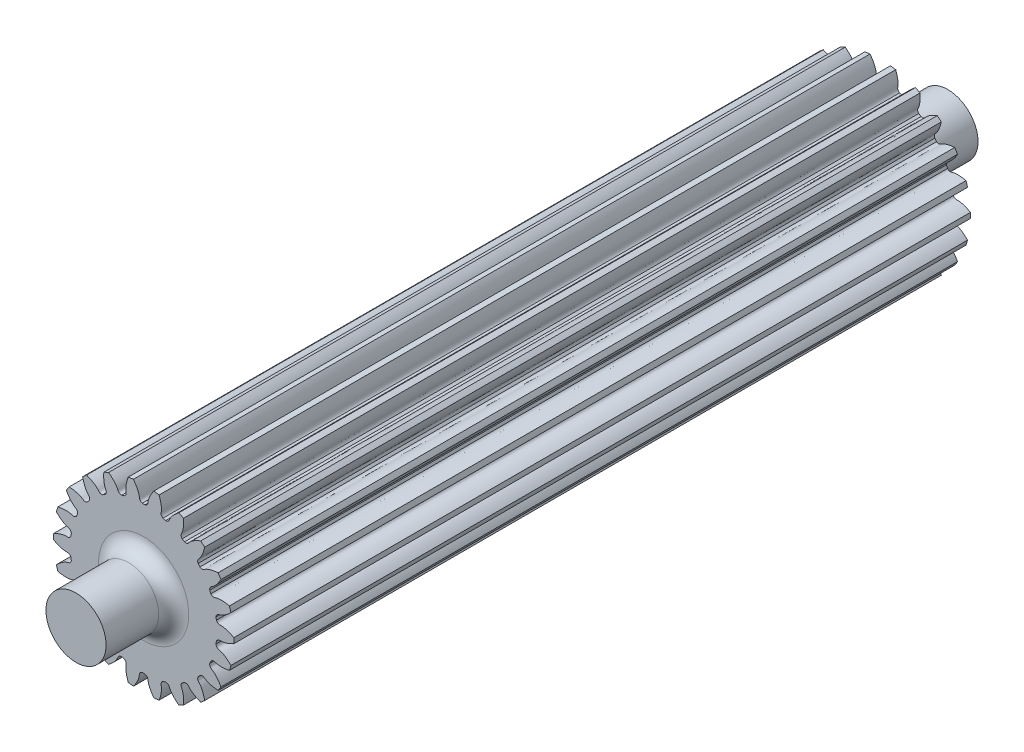
from build123d import *
from build123d.topology import SkipClean

# Parameters (mm, degrees)
SKETCH_1_R               = 12
EXTRUDE_1_DEPTH          = 30
CUT_EXTRUDE_1_DEPTH      = 35.467375879
PATTERN_CIRCULAR_1_COUNT = 22
EXTRUDE_START            = 68
EXTRUDE_2_DEPTH          = 68
SKETCH_19_R              = 4
EXTRUDE_3_DEPTH          = 9
EXTRUDE_START_2          = 9
SKETCH_20_R              = 4
EXTRUDE_4_DEPTH          = 9
FILLET_1_R               = 2
FILLET_2_R               = 2


with BuildPart() as part:
    # 草图1 → 凸台-拉伸1 (new body)
    with BuildSketch(Plane.XY):
        Circle(SKETCH_1_R)
    extrude(amount=EXTRUDE_1_DEPTH)

    # 草图2 → 切除-拉伸1 (cut, through all)
    with BuildSketch(Plane.XY):
        with BuildLine():
            ThreePointArc((0.185665431, 9.748232063), (0, 9.75), (-0.185665431, 9.748232063))
            add(Edge.make_bspline(
                [(-0.185665431, 9.748232063), (-0.588158706, 9.876186429), (-0.548347264, 10.151774696), (-0.599584047, 10.42157039), (-0.60596118, 10.451918903), (-0.613876897, 10.486162213), (-0.623483721, 10.524250431), (-0.634939934, 10.566127653), (-0.648399943, 10.611733662), (-0.664017171, 10.661003439), (-0.681942991, 10.713867378), (-0.70232689, 10.77025128), (-0.72531626, 10.830076418), (-0.751056303, 10.893259589), (-0.779689902, 10.959713172), (-0.811357505, 11.029345185), (-0.846197011, 11.10205935), (-0.884343649, 11.177755162), (-0.925929868, 11.25632795), (-0.971085225, 11.337668957), (-1.019936271, 11.421665408), (-1.072606448, 11.508200591), (-1.129215979, 11.597153935), (-1.189881763, 11.688401095), (-1.254717274, 11.781814033), (-1.323832459, 11.877261111), (-1.397333644, 11.974607178), (-1.475323431, 12.073713662), (-1.557900608, 12.174438668), (-1.64516006, 12.276637076), (-1.737192673, 12.380160638), (-1.834085256, 12.484858081), (-1.935920447, 12.590575215), (-2.042776642, 12.697155033), (-2.154727905, 12.804437827), (-2.271843904, 12.912261294), (-2.394189822, 13.020460649), (-2.521826308, 13.128868741), (-2.654809363, 13.237316171), (-2.841488127, 13.383435539), (-2.986445715, 13.489968103), (-3.085558798, 13.559868128)],
                knots=[0, 0, 0, 0, 0.157021319, 0.162530984, 0.168888289, 0.176093235, 0.184145822, 0.19304605, 0.202793918, 0.213389427, 0.224832576, 0.237123367, 0.250261798, 0.264247869, 0.279081582, 0.294762935, 0.311291928, 0.328668563, 0.346892838, 0.365964754, 0.38588431, 0.406651508, 0.428266346, 0.450728824, 0.474038944, 0.498196704, 0.523202104, 0.549055146, 0.575755828, 0.603304151, 0.631700114, 0.660943719, 0.691034964, 0.721973849, 0.753760376, 0.786394543, 0.819876351, 0.854205799, 0.889382888, 0.925407618, 1, 1, 1, 1], degree=3))
            ThreePointArc((-3.085558798, 13.559868128), (0, 13.906498364), (3.085558798, 13.559868128))
            add(Edge.make_bspline(
                [(0.185665431, 9.748232063), (0.588158706, 9.876186429), (0.548347264, 10.151774696), (0.599584047, 10.42157039), (0.60596118, 10.451918903), (0.613876897, 10.486162213), (0.623483721, 10.524250431), (0.634939934, 10.566127653), (0.648399943, 10.611733662), (0.664017171, 10.661003439), (0.681942991, 10.713867378), (0.70232689, 10.77025128), (0.72531626, 10.830076418), (0.751056303, 10.893259589), (0.779689902, 10.959713172), (0.811357505, 11.029345185), (0.846197011, 11.10205935), (0.884343649, 11.177755162), (0.925929868, 11.25632795), (0.971085225, 11.337668957), (1.019936271, 11.421665408), (1.072606448, 11.508200591), (1.129215979, 11.597153935), (1.189881763, 11.688401095), (1.254717274, 11.781814033), (1.323832459, 11.877261111), (1.397333644, 11.974607178), (1.475323431, 12.073713662), (1.557900608, 12.174438668), (1.64516006, 12.276637076), (1.737192673, 12.380160638), (1.834085256, 12.484858081), (1.935920447, 12.590575215), (2.042776642, 12.697155033), (2.154727905, 12.804437827), (2.271843904, 12.912261294), (2.394189822, 13.020460649), (2.521826308, 13.128868741), (2.654809363, 13.237316171), (2.841488127, 13.383435539), (2.986445715, 13.489968103), (3.085558798, 13.559868128)],
                knots=[0, 0, 0, 0, 0.157021319, 0.162530984, 0.168888289, 0.176093235, 0.184145822, 0.19304605, 0.202793918, 0.213389427, 0.224832576, 0.237123367, 0.250261798, 0.264247869, 0.279081582, 0.294762935, 0.311291928, 0.328668563, 0.346892838, 0.365964754, 0.38588431, 0.406651508, 0.428266346, 0.450728824, 0.474038944, 0.498196704, 0.523202104, 0.549055146, 0.575755828, 0.603304151, 0.631700114, 0.660943719, 0.691034964, 0.721973849, 0.753760376, 0.786394543, 0.819876351, 0.854205799, 0.889382888, 0.925407618, 1, 1, 1, 1], degree=3))
        make_face()
    cut_extrude_1 = extrude(amount=CUT_EXTRUDE_1_DEPTH, mode=Mode.SUBTRACT)

    # 阵列(圆周)1: 切除-拉伸1 ×22 about axis
    pattern_circular_1_axis = Axis((0, 0, -1.5), (0, 0, 1))
    for i in range(1, PATTERN_CIRCULAR_1_COUNT):
        add(cut_extrude_1.rotate(pattern_circular_1_axis, i * 360 / PATTERN_CIRCULAR_1_COUNT), mode=Mode.SUBTRACT)

    # 草图4 → 凸台-拉伸2 (add)
    with BuildSketch(Plane(origin=(0, 0, 0), x_dir=(-1, 0, 0), z_dir=(0, 0, -1)).offset(EXTRUDE_START)):
        with BuildLine():
            ThreePointArc((2.924539021, 9.301052173), (2.746892429, 9.355056493), (2.568249667, 9.405668166))
            add(Edge.make_bspline(
                [(2.568249667, 9.405668166), (2.218109108, 9.641834941), (2.333950094, 9.895043767), (2.361944393, 10.180005258), (2.365849304, 10.238460497), (2.368085913, 10.32113962), (2.366834845, 10.420382901), (2.360772595, 10.536017252), (2.34858845, 10.667790208), (2.32898426, 10.815370787), (2.300679804, 10.978350119), (2.26241667, 11.156242389), (2.212962422, 11.348485973), (2.151114634, 11.554444777), (2.096274933, 11.713680077), (2.062581682, 11.80433527), (2.055688884, 11.822611522)],
                knots=[0, 0, 0, 0, 0.157021319, 0.162530984, 0.176093235, 0.19304605, 0.213389427, 0.237123367, 0.264247869, 0.294762935, 0.328668563, 0.365964754, 0.406651508, 0.450728824, 0.498196704, 0.510209942, 0.510209942, 0.510209942, 0.510209942], degree=3))
            ThreePointArc((2.055688884, 11.822611522), (1.707778059, 11.877857303), (1.358395532, 11.922867171))
            add(Edge.make_bspline(
                [(1.358395532, 11.922867171), (1.300155371, 11.845656586), (1.201946581, 11.708817962), (1.073915974, 11.512256119), (0.972303664, 11.341732625), (0.885472389, 11.181826213), (0.812397844, 11.033422979), (0.752009469, 10.897343589), (0.703194045, 10.774341044), (0.670055832, 10.680054419), (0.644027119, 10.597938124), (0.627360159, 10.539619361), (0.611348785, 10.476138997), (0.60176986, 10.433080149), (0.548347264, 10.151774696), (0.588158706, 9.876186429), (0.185665431, 9.748232063)],
                knots=[0.489790058, 0.489790058, 0.489790058, 0.489790058, 0.549271176, 0.593348492, 0.634035246, 0.671331437, 0.705237065, 0.735752131, 0.762876633, 0.786610573, 0.797206082, 0.815854178, 0.823906765, 0.837469016, 0.842978681, 1, 1, 1, 1], degree=3))
            ThreePointArc((0.185665431, 9.748232063), (0, 9.75), (-0.185665431, 9.748232063))
            add(Edge.make_bspline(
                [(-0.185665431, 9.748232063), (-0.588158706, 9.876186429), (-0.548347264, 10.151774696), (-0.60176986, 10.433080149), (-0.61449187, 10.490267681), (-0.635639261, 10.570227844), (-0.664799714, 10.665098608), (-0.703194362, 10.774341023), (-0.752009695, 10.897343577), (-0.812398032, 11.033422968), (-0.885472542, 11.181826205), (-0.972303795, 11.341732617), (-1.073916075, 11.512256114), (-1.191283893, 11.692447604), (-1.288763969, 11.829782626), (-1.346632927, 11.907273161), (-1.358395532, 11.922867171)],
                knots=[0, 0, 0, 0, 0.157021319, 0.162530984, 0.176093235, 0.19304605, 0.213389427, 0.237123367, 0.264247869, 0.294762935, 0.328668563, 0.365964754, 0.406651508, 0.450728824, 0.498196704, 0.510209942, 0.510209942, 0.510209942, 0.510209942], degree=3))
            ThreePointArc((-1.358395532, 11.922867171), (-1.707778059, 11.877857303), (-2.055688884, 11.822611522))
            add(Edge.make_bspline(
                [(-2.055688884, 11.822611522), (-2.089817174, 11.732120359), (-2.145495923, 11.573156047), (-2.21296252, 11.34848595), (-2.262416797, 11.156242359), (-2.300679954, 10.978350084), (-2.328984444, 10.815370745), (-2.348588671, 10.667790156), (-2.360772906, 10.536017183), (-2.366005176, 10.436213716), (-2.36784471, 10.350090571), (-2.367406247, 10.289438503), (-2.364884562, 10.224018615), (-2.361944393, 10.180005258), (-2.333950094, 9.895043767), (-2.218109108, 9.641834941), (-2.568249667, 9.405668166)],
                knots=[0.489790058, 0.489790058, 0.489790058, 0.489790058, 0.549271176, 0.593348492, 0.634035246, 0.671331437, 0.705237065, 0.735752131, 0.762876633, 0.786610573, 0.797206082, 0.815854178, 0.823906765, 0.837469016, 0.842978681, 1, 1, 1, 1], degree=3))
            ThreePointArc((-2.568249667, 9.405668166), (-2.746892429, 9.355056493), (-2.924539021, 9.301052173))
            add(Edge.make_bspline(
                [(-2.924539021, 9.301052173), (-3.3467774, 9.310428028), (-3.386220788, 9.586069213), (-3.516732299, 9.840928935), (-3.545050567, 9.892215766), (-3.587868721, 9.962979072), (-3.642576155, 10.045791454), (-3.710192695, 10.139791761), (-3.791684488, 10.244058979), (-3.887964667, 10.357612838), (-3.999889169, 10.479417233), (-4.128253989, 10.608383121), (-4.273792278, 10.74337173), (-4.437171685, 10.883197863), (-4.569394878, 10.987506541), (-4.646751344, 11.045554595), (-4.662430821, 11.057203029)],
                knots=[0, 0, 0, 0, 0.157021319, 0.162530984, 0.176093235, 0.19304605, 0.213389427, 0.237123367, 0.264247869, 0.294762935, 0.328668563, 0.365964754, 0.406651508, 0.450728824, 0.498196704, 0.510209942, 0.510209942, 0.510209942, 0.510209942], degree=3))
            ThreePointArc((-4.662430821, 11.057203029), (-4.984980156, 10.915583944), (-5.303233613, 10.7645582))
            add(Edge.make_bspline(
                [(-5.303233613, 10.7645582), (-5.310485161, 10.668117515), (-5.319123107, 10.499905858), (-5.320559952, 10.265328941), (-5.313849705, 10.066939687), (-5.300444889, 9.885473322), (-5.281686262, 9.721121495), (-5.258918124, 9.573995807), (-5.233484075, 9.44412787), (-5.210386516, 9.346893044), (-5.187887842, 9.263740235), (-5.170379477, 9.205668531), (-5.149529026, 9.143609049), (-5.134307959, 9.102206883), (-5.027164697, 8.83667524), (-4.844678915, 8.626359328), (-5.114100451, 8.301112972)],
                knots=[0.489790058, 0.489790058, 0.489790058, 0.489790058, 0.549271176, 0.593348492, 0.634035246, 0.671331437, 0.705237065, 0.735752131, 0.762876633, 0.786610573, 0.797206082, 0.815854178, 0.823906765, 0.837469016, 0.842978681, 1, 1, 1, 1], degree=3))
            ThreePointArc((-5.114100451, 8.301112972), (-5.27124797, 8.202221945), (-5.426483851, 8.100356351))
            add(Edge.make_bspline(
                [(-5.426483851, 8.100356351), (-5.834260094, 7.99039412), (-5.949762843, 8.243757414), (-6.146790001, 8.451524185), (-6.188410351, 8.49275536), (-6.249430396, 8.548588987), (-6.325252738, 8.612634021), (-6.41661328, 8.683776874), (-6.524179553, 8.760861647), (-6.648551527, 8.842690515), (-6.790258564, 8.928028199), (-6.949757596, 9.015605514), (-7.127431248, 9.104123262), (-7.323586215, 9.192256156), (-7.479840591, 9.255088021), (-7.570417602, 9.288990887), (-7.588743694, 9.295750058)],
                knots=[0, 0, 0, 0, 0.157021319, 0.162530984, 0.176093235, 0.19304605, 0.213389427, 0.237123367, 0.264247869, 0.294762935, 0.328668563, 0.365964754, 0.406651508, 0.450728824, 0.498196704, 0.510209942, 0.510209942, 0.510209942, 0.510209942], degree=3))
            ThreePointArc((-7.588743694, 9.295750058), (-7.858328807, 9.068994892), (-8.121141894, 8.834424392))
            add(Edge.make_bspline(
                [(-8.121141894, 8.834424392), (-8.100929222, 8.739847235), (-8.061826571, 8.576015742), (-7.997117259, 8.350536032), (-7.934786112, 8.162073431), (-7.870799303, 7.991734302), (-7.806497272, 7.839324794), (-7.743201307, 7.704573257), (-7.68220949, 7.587131484), (-7.632653327, 7.500342686), (-7.587639155, 7.426896759), (-7.554479312, 7.376110043), (-7.516989274, 7.322438657), (-7.49072043, 7.287001839), (-7.313108313, 7.06241184), (-7.078761648, 6.912027385), (-7.245637231, 6.524050974)],
                knots=[0.489790058, 0.489790058, 0.489790058, 0.489790058, 0.549271176, 0.593348492, 0.634035246, 0.671331437, 0.705237065, 0.735752131, 0.762876633, 0.786610573, 0.797206082, 0.815854178, 0.823906765, 0.837469016, 0.842978681, 1, 1, 1, 1], degree=3))
            ThreePointArc((-7.245637231, 6.524050974), (-7.36855835, 6.384892156), (-7.488807233, 6.243417832))
            add(Edge.make_bspline(
                [(-7.488807233, 6.243417832), (-7.849085732, 6.023026001), (-8.031290497, 6.233585417), (-8.278871334, 6.377427208), (-8.330421932, 6.405262424), (-8.404700387, 6.441643063), (-8.495494963, 6.481732201), (-8.603198018, 6.52425403), (-8.728124391, 6.567911406), (-8.870512283, 6.611385996), (-9.030521594, 6.653343419), (-9.208233175, 6.692437167), (-9.403648127, 6.727312872), (-9.616687345, 6.756612524), (-9.784314102, 6.772877312), (-9.88077365, 6.77988838), (-9.900261685, 6.781210701)],
                knots=[0, 0, 0, 0, 0.157021319, 0.162530984, 0.176093235, 0.19304605, 0.213389427, 0.237123367, 0.264247869, 0.294762935, 0.328668563, 0.365964754, 0.406651508, 0.450728824, 0.498196704, 0.510209942, 0.510209942, 0.510209942, 0.510209942], degree=3))
            ThreePointArc((-9.900261685, 6.781210701), (-10.095042394, 6.487689809), (-10.281123557, 6.188578059))
            add(Edge.make_bspline(
                [(-10.281123557, 6.188578059), (-10.235084176, 6.103526509), (-10.151408791, 5.957347833), (-10.025795686, 5.759232356), (-9.912893339, 5.595964528), (-9.803508366, 5.450552498), (-9.698872299, 5.322432622), (-9.60017637, 5.210972003), (-9.508567979, 5.115470827), (-9.43656796, 5.046159169), (-9.372685068, 4.988370276), (-9.326560161, 4.948982987), (-9.275467756, 4.908047833), (-9.240279279, 4.881447244), (-9.006587387, 4.715993833), (-8.739365211, 4.637724091), (-8.790175575, 4.218449166)],
                knots=[0.489790058, 0.489790058, 0.489790058, 0.489790058, 0.549271176, 0.593348492, 0.634035246, 0.671331437, 0.705237065, 0.735752131, 0.762876633, 0.786610573, 0.797206082, 0.815854178, 0.823906765, 0.837469016, 0.842978681, 1, 1, 1, 1], degree=3))
            ThreePointArc((-8.790175575, 4.218449166), (-8.868911955, 4.050296377), (-8.94443199, 3.880674732))
            add(Edge.make_bspline(
                [(-8.94443199, 3.880674732), (-9.228025124, 3.567708136), (-9.462170759, 3.718405401), (-9.740247748, 3.786669007), (-9.797552271, 3.798853219), (-9.879071537, 3.812833528), (-9.97748271, 3.825718986), (-10.092802818, 3.836174925), (-10.2249685, 3.842868044), (-10.373836889, 3.844466303), (-10.53918547, 3.839644323), (-10.720712465, 3.827087362), (-10.91803736, 3.805495601), (-11.130701659, 3.773588328), (-11.296120675, 3.741968363), (-11.390648179, 3.721519639), (-11.409719353, 3.717297982)],
                knots=[0, 0, 0, 0, 0.157021319, 0.162530984, 0.176093235, 0.19304605, 0.213389427, 0.237123367, 0.264247869, 0.294762935, 0.328668563, 0.365964754, 0.406651508, 0.450728824, 0.498196704, 0.510209942, 0.510209942, 0.510209942, 0.510209942], degree=3))
            ThreePointArc((-11.409719353, 3.717297982), (-11.513915683, 3.380790682), (-11.608189734, 3.041369937))
            add(Edge.make_bspline(
                [(-11.608189734, 3.041369937), (-11.540053481, 2.972734366), (-11.418584245, 2.856051033), (-11.242243773, 2.701349926), (-11.087916901, 2.576503859), (-10.941995486, 2.467799346), (-10.805502374, 2.374348612), (-10.679402238, 2.295208787), (-10.564598841, 2.229385146), (-10.475987977, 2.183165848), (-10.398411779, 2.145715701), (-10.343058573, 2.120918762), (-10.282503004, 2.096036163), (-10.241245656, 2.080426825), (-9.970406315, 1.987514054), (-9.69195738, 1.987699973), (-9.62258617, 1.571093695)],
                knots=[0.489790058, 0.489790058, 0.489790058, 0.489790058, 0.549271176, 0.593348492, 0.634035246, 0.671331437, 0.705237065, 0.735752131, 0.762876633, 0.786610573, 0.797206082, 0.815854178, 0.823906765, 0.837469016, 0.842978681, 1, 1, 1, 1], degree=3))
            ThreePointArc((-9.62258617, 1.571093695), (-9.650759058, 1.387569673), (-9.675432062, 1.203542444))
            add(Edge.make_bspline(
                [(-9.675432062, 1.203542444), (-9.859364802, 0.823355776), (-10.126482219, 0.901982294), (-10.412527217, 0.889137403), (-10.470943193, 0.88468352), (-10.553099064, 0.875130897), (-10.651154146, 0.859768772), (-10.764748758, 0.837311742), (-10.893446471, 0.806498368), (-11.036734926, 0.766090814), (-11.194027219, 0.71488008), (-11.36466339, 0.651689699), (-11.547912138, 0.575379709), (-11.742972721, 0.484850449), (-11.892782731, 0.407907392), (-11.977720136, 0.361655509), (-11.994829415, 0.352231889)],
                knots=[0, 0, 0, 0, 0.157021319, 0.162530984, 0.176093235, 0.19304605, 0.213389427, 0.237123367, 0.264247869, 0.294762935, 0.328668563, 0.365964754, 0.406651508, 0.450728824, 0.498196704, 0.510209942, 0.510209942, 0.510209942, 0.510209942], degree=3))
            ThreePointArc((-11.994829415, 0.352231889), (-12, 0), (-11.994829415, -0.352231889))
            add(Edge.make_bspline(
                [(-11.994829415, -0.352231889), (-11.910116284, -0.398891037), (-11.760693911, -0.476626036), (-11.547912129, -0.57537981), (-11.364663379, -0.651689829), (-11.194027205, -0.714880233), (-11.03673491, -0.766091002), (-10.89344645, -0.806498594), (-10.764748734, -0.83731206), (-10.666705752, -0.856694587), (-10.58172101, -0.870771999), (-10.521623893, -0.878969688), (-10.456511011, -0.885783891), (-10.412527217, -0.889137403), (-10.126482219, -0.901982294), (-9.859364802, -0.823355776), (-9.675432062, -1.203542444)],
                knots=[0.489790058, 0.489790058, 0.489790058, 0.489790058, 0.549271176, 0.593348492, 0.634035246, 0.671331437, 0.705237065, 0.735752131, 0.762876633, 0.786610573, 0.797206082, 0.815854178, 0.823906765, 0.837469016, 0.842978681, 1, 1, 1, 1], degree=3))
            ThreePointArc((-9.675432062, -1.203542444), (-9.650759058, -1.387569673), (-9.62258617, -1.571093695))
            add(Edge.make_bspline(
                [(-9.62258617, -1.571093695), (-9.69195738, -1.987699973), (-9.970406315, -1.987514054), (-10.241245656, -2.080426825), (-10.296040571, -2.101157977), (-10.372177267, -2.133469636), (-10.461932418, -2.175834796), (-10.564598775, -2.229385458), (-10.679402194, -2.29520901), (-10.805502337, -2.374348797), (-10.941995455, -2.467799496), (-11.087916875, -2.576503987), (-11.242243753, -2.701350024), (-11.403897972, -2.843167131), (-11.52596226, -2.959199811), (-11.594428442, -3.027507799), (-11.608189734, -3.041369937)],
                knots=[0, 0, 0, 0, 0.157021319, 0.162530984, 0.176093235, 0.19304605, 0.213389427, 0.237123367, 0.264247869, 0.294762935, 0.328668563, 0.365964754, 0.406651508, 0.450728824, 0.498196704, 0.510209942, 0.510209942, 0.510209942, 0.510209942], degree=3))
            ThreePointArc((-11.608189734, -3.041369937), (-11.513915683, -3.380790682), (-11.409719353, -3.717297982))
            add(Edge.make_bspline(
                [(-11.409719353, -3.717297982), (-11.315292297, -3.73820066), (-11.150022101, -3.770689699), (-10.918037323, -3.805495695), (-10.720712418, -3.827087483), (-10.539185414, -3.839644466), (-10.373836821, -3.844466479), (-10.224968417, -3.842868255), (-10.092802706, -3.836175223), (-9.993270464, -3.827150722), (-9.907762136, -3.816714931), (-9.847789818, -3.807649241), (-9.783394683, -3.795843002), (-9.740247748, -3.786669007), (-9.462170759, -3.718405401), (-9.228025124, -3.567708136), (-8.94443199, -3.880674732)],
                knots=[0.489790058, 0.489790058, 0.489790058, 0.489790058, 0.549271176, 0.593348492, 0.634035246, 0.671331437, 0.705237065, 0.735752131, 0.762876633, 0.786610573, 0.797206082, 0.815854178, 0.823906765, 0.837469016, 0.842978681, 1, 1, 1, 1], degree=3))
            ThreePointArc((-8.94443199, -3.880674732), (-8.868911955, -4.050296377), (-8.790175575, -4.218449166))
            add(Edge.make_bspline(
                [(-8.790175575, -4.218449166), (-8.739365211, -4.637724091), (-9.006587387, -4.715993833), (-9.240279279, -4.881447244), (-9.287013975, -4.916776151), (-9.350963354, -4.969229146), (-9.425147146, -5.035165168), (-9.508567828, -5.115471107), (-9.600176265, -5.210972204), (-9.698872211, -5.322432789), (-9.803508295, -5.450552634), (-9.912893278, -5.595964644), (-10.02579564, -5.759232445), (-10.14094723, -5.940848218), (-10.225376874, -6.086570243), (-10.27182511, -6.171400431), (-10.281123557, -6.188578059)],
                knots=[0, 0, 0, 0, 0.157021319, 0.162530984, 0.176093235, 0.19304605, 0.213389427, 0.237123367, 0.264247869, 0.294762935, 0.328668563, 0.365964754, 0.406651508, 0.450728824, 0.498196704, 0.510209942, 0.510209942, 0.510209942, 0.510209942], degree=3))
            ThreePointArc((-10.281123557, -6.188578059), (-10.095042394, -6.487689809), (-9.900261685, -6.781210701))
            add(Edge.make_bspline(
                [(-9.900261685, -6.781210701), (-9.803770624, -6.774663498), (-9.636041811, -6.759274507), (-9.403648065, -6.727312951), (-9.208233095, -6.69243727), (-9.0305215, -6.65334354), (-8.870512168, -6.611386145), (-8.728124252, -6.567911585), (-8.603197826, -6.524254284), (-8.510239836, -6.487553866), (-8.431135298, -6.453450317), (-8.37614638, -6.427855698), (-8.317685902, -6.398385488), (-8.278871334, -6.377427208), (-8.031290497, -6.233585417), (-7.849085732, -6.023026001), (-7.488807233, -6.243417832)],
                knots=[0.489790058, 0.489790058, 0.489790058, 0.489790058, 0.549271176, 0.593348492, 0.634035246, 0.671331437, 0.705237065, 0.735752131, 0.762876633, 0.786610573, 0.797206082, 0.815854178, 0.823906765, 0.837469016, 0.842978681, 1, 1, 1, 1], degree=3))
            ThreePointArc((-7.488807233, -6.243417832), (-7.36855835, -6.384892156), (-7.245637231, -6.524050974))
            add(Edge.make_bspline(
                [(-7.245637231, -6.524050974), (-7.078761648, -6.912027385), (-7.313108313, -7.06241184), (-7.49072043, -7.287001839), (-7.525608738, -7.334066362), (-7.572190001, -7.402411265), (-7.624792505, -7.486576403), (-7.682209266, -7.58713171), (-7.743201149, -7.70457342), (-7.80649714, -7.83932493), (-7.870799196, -7.991734412), (-7.934786021, -8.162073525), (-7.997117189, -8.350536104), (-8.056437255, -8.557237115), (-8.096392266, -8.720842953), (-8.117059596, -8.815322902), (-8.121141894, -8.834424392)],
                knots=[0, 0, 0, 0, 0.157021319, 0.162530984, 0.176093235, 0.19304605, 0.213389427, 0.237123367, 0.264247869, 0.294762935, 0.328668563, 0.365964754, 0.406651508, 0.450728824, 0.498196704, 0.510209942, 0.510209942, 0.510209942, 0.510209942], degree=3))
            ThreePointArc((-8.121141894, -8.834424392), (-7.858328807, -9.068994892), (-7.588743694, -9.295750058))
            add(Edge.make_bspline(
                [(-7.588743694, -9.295750058), (-7.498005759, -9.262283389), (-7.341406722, -9.200263094), (-7.127431166, -9.104123321), (-6.94975749, -9.015605591), (-6.79025844, -8.928028289), (-6.648551375, -8.842690626), (-6.524179369, -8.760861779), (-6.416613024, -8.683777064), (-6.337760188, -8.622373978), (-6.271468019, -8.56736554), (-6.225917377, -8.527315513), (-6.178127677, -8.482568835), (-6.146790001, -8.451524185), (-5.949762843, -8.243757414), (-5.834260094, -7.99039412), (-5.426483851, -8.100356351)],
                knots=[0.489790058, 0.489790058, 0.489790058, 0.489790058, 0.549271176, 0.593348492, 0.634035246, 0.671331437, 0.705237065, 0.735752131, 0.762876633, 0.786610573, 0.797206082, 0.815854178, 0.823906765, 0.837469016, 0.842978681, 1, 1, 1, 1], degree=3))
            ThreePointArc((-5.426483851, -8.100356351), (-5.27124797, -8.202221945), (-5.114100451, -8.301112972))
            add(Edge.make_bspline(
                [(-5.114100451, -8.301112972), (-4.844678915, -8.626359328), (-5.027164697, -8.83667524), (-5.134307959, -9.102206883), (-5.154523438, -9.157194134), (-5.179962849, -9.235894046), (-5.206722521, -9.331469743), (-5.233483796, -9.444128024), (-5.258917927, -9.573995919), (-5.281686098, -9.721121587), (-5.300444756, -9.885473397), (-5.313849591, -10.066939751), (-5.320559864, -10.265328991), (-5.319242647, -10.480369552), (-5.311486107, -10.648604832), (-5.304698188, -10.745080339), (-5.303233613, -10.7645582)],
                knots=[0, 0, 0, 0, 0.157021319, 0.162530984, 0.176093235, 0.19304605, 0.213389427, 0.237123367, 0.264247869, 0.294762935, 0.328668563, 0.365964754, 0.406651508, 0.450728824, 0.498196704, 0.510209942, 0.510209942, 0.510209942, 0.510209942], degree=3))
            ThreePointArc((-5.303233613, -10.7645582), (-4.984980156, -10.915583944), (-4.662430821, -11.057203029))
            add(Edge.make_bspline(
                [(-4.662430821, -11.057203029), (-4.584797061, -10.999528165), (-4.452014522, -10.89590108), (-4.273792183, -10.743371764), (-4.128253866, -10.608383165), (-3.999889025, -10.479417284), (-3.887964489, -10.357612901), (-3.791684274, -10.244059055), (-3.710192396, -10.139791871), (-3.651832902, -10.05866063), (-3.6037237, -9.987203758), (-3.571301575, -9.93594294), (-3.538054289, -9.879544902), (-3.516732299, -9.840928935), (-3.386220788, -9.586069213), (-3.3467774, -9.310428028), (-2.924539021, -9.301052173)],
                knots=[0.489790058, 0.489790058, 0.489790058, 0.489790058, 0.549271176, 0.593348492, 0.634035246, 0.671331437, 0.705237065, 0.735752131, 0.762876633, 0.786610573, 0.797206082, 0.815854178, 0.823906765, 0.837469016, 0.842978681, 1, 1, 1, 1], degree=3))
            ThreePointArc((-2.924539021, -9.301052173), (-2.746892429, -9.355056493), (-2.568249667, -9.405668166))
            add(Edge.make_bspline(
                [(-2.568249667, -9.405668166), (-2.218109108, -9.641834941), (-2.333950094, -9.895043767), (-2.361944393, -10.180005258), (-2.365849304, -10.238460497), (-2.368085913, -10.32113962), (-2.366834845, -10.420382901), (-2.360772595, -10.536017252), (-2.34858845, -10.667790208), (-2.32898426, -10.815370787), (-2.300679804, -10.978350119), (-2.26241667, -11.156242389), (-2.212962422, -11.348485973), (-2.151114634, -11.554444777), (-2.096274933, -11.713680077), (-2.062581682, -11.80433527), (-2.055688884, -11.822611522)],
                knots=[0, 0, 0, 0, 0.157021319, 0.162530984, 0.176093235, 0.19304605, 0.213389427, 0.237123367, 0.264247869, 0.294762935, 0.328668563, 0.365964754, 0.406651508, 0.450728824, 0.498196704, 0.510209942, 0.510209942, 0.510209942, 0.510209942], degree=3))
            ThreePointArc((-2.055688884, -11.822611522), (-1.707778059, -11.877857303), (-1.358395532, -11.922867171))
            add(Edge.make_bspline(
                [(-1.358395532, -11.922867171), (-1.300155371, -11.845656586), (-1.201946581, -11.708817962), (-1.073915974, -11.512256119), (-0.972303664, -11.341732625), (-0.885472389, -11.181826213), (-0.812397844, -11.033422979), (-0.752009469, -10.897343589), (-0.703194045, -10.774341044), (-0.670055832, -10.680054419), (-0.644027119, -10.597938124), (-0.627360159, -10.539619361), (-0.611348785, -10.476138997), (-0.60176986, -10.433080149), (-0.548347264, -10.151774696), (-0.588158706, -9.876186429), (-0.185665431, -9.748232063)],
                knots=[0.489790058, 0.489790058, 0.489790058, 0.489790058, 0.549271176, 0.593348492, 0.634035246, 0.671331437, 0.705237065, 0.735752131, 0.762876633, 0.786610573, 0.797206082, 0.815854178, 0.823906765, 0.837469016, 0.842978681, 1, 1, 1, 1], degree=3))
            ThreePointArc((-0.185665431, -9.748232063), (0, -9.75), (0.185665431, -9.748232063))
            add(Edge.make_bspline(
                [(0.185665431, -9.748232063), (0.588158706, -9.876186429), (0.548347264, -10.151774696), (0.60176986, -10.433080149), (0.61449187, -10.490267681), (0.635639261, -10.570227844), (0.664799714, -10.665098608), (0.703194362, -10.774341023), (0.752009695, -10.897343577), (0.812398032, -11.033422968), (0.885472542, -11.181826205), (0.972303795, -11.341732617), (1.073916075, -11.512256114), (1.191283893, -11.692447604), (1.288763969, -11.829782626), (1.346632927, -11.907273161), (1.358395532, -11.922867171)],
                knots=[0, 0, 0, 0, 0.157021319, 0.162530984, 0.176093235, 0.19304605, 0.213389427, 0.237123367, 0.264247869, 0.294762935, 0.328668563, 0.365964754, 0.406651508, 0.450728824, 0.498196704, 0.510209942, 0.510209942, 0.510209942, 0.510209942], degree=3))
            ThreePointArc((1.358395532, -11.922867171), (1.707778059, -11.877857303), (2.055688884, -11.822611522))
            add(Edge.make_bspline(
                [(2.055688884, -11.822611522), (2.089817174, -11.732120359), (2.145495923, -11.573156047), (2.21296252, -11.34848595), (2.262416797, -11.156242359), (2.300679954, -10.978350084), (2.328984444, -10.815370745), (2.348588671, -10.667790156), (2.360772906, -10.536017183), (2.366005176, -10.436213716), (2.36784471, -10.350090571), (2.367406247, -10.289438503), (2.364884562, -10.224018615), (2.361944393, -10.180005258), (2.333950094, -9.895043767), (2.218109108, -9.641834941), (2.568249667, -9.405668166)],
                knots=[0.489790058, 0.489790058, 0.489790058, 0.489790058, 0.549271176, 0.593348492, 0.634035246, 0.671331437, 0.705237065, 0.735752131, 0.762876633, 0.786610573, 0.797206082, 0.815854178, 0.823906765, 0.837469016, 0.842978681, 1, 1, 1, 1], degree=3))
            ThreePointArc((2.568249667, -9.405668166), (2.746892429, -9.355056493), (2.924539021, -9.301052173))
            add(Edge.make_bspline(
                [(2.924539021, -9.301052173), (3.3467774, -9.310428028), (3.386220788, -9.586069213), (3.516732299, -9.840928935), (3.545050567, -9.892215766), (3.587868721, -9.962979072), (3.642576155, -10.045791454), (3.710192695, -10.139791761), (3.791684488, -10.244058979), (3.887964667, -10.357612838), (3.999889169, -10.479417233), (4.128253989, -10.608383121), (4.273792278, -10.74337173), (4.437171685, -10.883197863), (4.569394878, -10.987506541), (4.646751344, -11.045554595), (4.662430821, -11.057203029)],
                knots=[0, 0, 0, 0, 0.157021319, 0.162530984, 0.176093235, 0.19304605, 0.213389427, 0.237123367, 0.264247869, 0.294762935, 0.328668563, 0.365964754, 0.406651508, 0.450728824, 0.498196704, 0.510209942, 0.510209942, 0.510209942, 0.510209942], degree=3))
            ThreePointArc((4.662430821, -11.057203029), (4.984980156, -10.915583944), (5.303233613, -10.7645582))
            add(Edge.make_bspline(
                [(5.303233613, -10.7645582), (5.310485161, -10.668117515), (5.319123107, -10.499905858), (5.320559952, -10.265328941), (5.313849705, -10.066939687), (5.300444889, -9.885473322), (5.281686262, -9.721121495), (5.258918124, -9.573995807), (5.233484075, -9.44412787), (5.210386516, -9.346893044), (5.187887842, -9.263740235), (5.170379477, -9.205668531), (5.149529026, -9.143609049), (5.134307959, -9.102206883), (5.027164697, -8.83667524), (4.844678915, -8.626359328), (5.114100451, -8.301112972)],
                knots=[0.489790058, 0.489790058, 0.489790058, 0.489790058, 0.549271176, 0.593348492, 0.634035246, 0.671331437, 0.705237065, 0.735752131, 0.762876633, 0.786610573, 0.797206082, 0.815854178, 0.823906765, 0.837469016, 0.842978681, 1, 1, 1, 1], degree=3))
            ThreePointArc((5.114100451, -8.301112972), (5.27124797, -8.202221945), (5.426483851, -8.100356351))
            add(Edge.make_bspline(
                [(5.426483851, -8.100356351), (5.834260094, -7.99039412), (5.949762843, -8.243757414), (6.146790001, -8.451524185), (6.188410351, -8.49275536), (6.249430396, -8.548588987), (6.325252738, -8.612634021), (6.41661328, -8.683776874), (6.524179553, -8.760861647), (6.648551527, -8.842690515), (6.790258564, -8.928028199), (6.949757596, -9.015605514), (7.127431248, -9.104123262), (7.323586215, -9.192256156), (7.479840591, -9.255088021), (7.570417602, -9.288990887), (7.588743694, -9.295750058)],
                knots=[0, 0, 0, 0, 0.157021319, 0.162530984, 0.176093235, 0.19304605, 0.213389427, 0.237123367, 0.264247869, 0.294762935, 0.328668563, 0.365964754, 0.406651508, 0.450728824, 0.498196704, 0.510209942, 0.510209942, 0.510209942, 0.510209942], degree=3))
            ThreePointArc((7.588743694, -9.295750058), (7.858328807, -9.068994892), (8.121141894, -8.834424392))
            add(Edge.make_bspline(
                [(8.121141894, -8.834424392), (8.100929222, -8.739847235), (8.061826571, -8.576015742), (7.997117259, -8.350536032), (7.934786112, -8.162073431), (7.870799303, -7.991734302), (7.806497272, -7.839324794), (7.743201307, -7.704573257), (7.68220949, -7.587131484), (7.632653327, -7.500342686), (7.587639155, -7.426896759), (7.554479312, -7.376110043), (7.516989274, -7.322438657), (7.49072043, -7.287001839), (7.313108313, -7.06241184), (7.078761648, -6.912027385), (7.245637231, -6.524050974)],
                knots=[0.489790058, 0.489790058, 0.489790058, 0.489790058, 0.549271176, 0.593348492, 0.634035246, 0.671331437, 0.705237065, 0.735752131, 0.762876633, 0.786610573, 0.797206082, 0.815854178, 0.823906765, 0.837469016, 0.842978681, 1, 1, 1, 1], degree=3))
            ThreePointArc((7.245637231, -6.524050974), (7.36855835, -6.384892156), (7.488807233, -6.243417832))
            add(Edge.make_bspline(
                [(7.488807233, -6.243417832), (7.849085732, -6.023026001), (8.031290497, -6.233585417), (8.278871334, -6.377427208), (8.330421932, -6.405262424), (8.404700387, -6.441643063), (8.495494963, -6.481732201), (8.603198018, -6.52425403), (8.728124391, -6.567911406), (8.870512283, -6.611385996), (9.030521594, -6.653343419), (9.208233175, -6.692437167), (9.403648127, -6.727312872), (9.616687345, -6.756612524), (9.784314102, -6.772877312), (9.88077365, -6.77988838), (9.900261685, -6.781210701)],
                knots=[0, 0, 0, 0, 0.157021319, 0.162530984, 0.176093235, 0.19304605, 0.213389427, 0.237123367, 0.264247869, 0.294762935, 0.328668563, 0.365964754, 0.406651508, 0.450728824, 0.498196704, 0.510209942, 0.510209942, 0.510209942, 0.510209942], degree=3))
            ThreePointArc((9.900261685, -6.781210701), (10.095042394, -6.487689809), (10.281123557, -6.188578059))
            add(Edge.make_bspline(
                [(10.281123557, -6.188578059), (10.235084176, -6.103526509), (10.151408791, -5.957347833), (10.025795686, -5.759232356), (9.912893339, -5.595964528), (9.803508366, -5.450552498), (9.698872299, -5.322432622), (9.60017637, -5.210972003), (9.508567979, -5.115470827), (9.43656796, -5.046159169), (9.372685068, -4.988370276), (9.326560161, -4.948982987), (9.275467756, -4.908047833), (9.240279279, -4.881447244), (9.006587387, -4.715993833), (8.739365211, -4.637724091), (8.790175575, -4.218449166)],
                knots=[0.489790058, 0.489790058, 0.489790058, 0.489790058, 0.549271176, 0.593348492, 0.634035246, 0.671331437, 0.705237065, 0.735752131, 0.762876633, 0.786610573, 0.797206082, 0.815854178, 0.823906765, 0.837469016, 0.842978681, 1, 1, 1, 1], degree=3))
            ThreePointArc((8.790175575, -4.218449166), (8.868911955, -4.050296377), (8.94443199, -3.880674732))
            add(Edge.make_bspline(
                [(8.94443199, -3.880674732), (9.228025124, -3.567708136), (9.462170759, -3.718405401), (9.740247748, -3.786669007), (9.797552271, -3.798853219), (9.879071537, -3.812833528), (9.97748271, -3.825718986), (10.092802818, -3.836174925), (10.2249685, -3.842868044), (10.373836889, -3.844466303), (10.53918547, -3.839644323), (10.720712465, -3.827087362), (10.91803736, -3.805495601), (11.130701659, -3.773588328), (11.296120675, -3.741968363), (11.390648179, -3.721519639), (11.409719353, -3.717297982)],
                knots=[0, 0, 0, 0, 0.157021319, 0.162530984, 0.176093235, 0.19304605, 0.213389427, 0.237123367, 0.264247869, 0.294762935, 0.328668563, 0.365964754, 0.406651508, 0.450728824, 0.498196704, 0.510209942, 0.510209942, 0.510209942, 0.510209942], degree=3))
            ThreePointArc((11.409719353, -3.717297982), (11.513915683, -3.380790682), (11.608189734, -3.041369937))
            add(Edge.make_bspline(
                [(11.608189734, -3.041369937), (11.540053481, -2.972734366), (11.418584245, -2.856051033), (11.242243773, -2.701349926), (11.087916901, -2.576503859), (10.941995486, -2.467799346), (10.805502374, -2.374348612), (10.679402238, -2.295208787), (10.564598841, -2.229385146), (10.475987977, -2.183165848), (10.398411779, -2.145715701), (10.343058573, -2.120918762), (10.282503004, -2.096036163), (10.241245656, -2.080426825), (9.970406315, -1.987514054), (9.69195738, -1.987699973), (9.62258617, -1.571093695)],
                knots=[0.489790058, 0.489790058, 0.489790058, 0.489790058, 0.549271176, 0.593348492, 0.634035246, 0.671331437, 0.705237065, 0.735752131, 0.762876633, 0.786610573, 0.797206082, 0.815854178, 0.823906765, 0.837469016, 0.842978681, 1, 1, 1, 1], degree=3))
            ThreePointArc((9.62258617, -1.571093695), (9.650759058, -1.387569673), (9.675432062, -1.203542444))
            add(Edge.make_bspline(
                [(9.675432062, -1.203542444), (9.859364802, -0.823355776), (10.126482219, -0.901982294), (10.412527217, -0.889137403), (10.470943193, -0.88468352), (10.553099064, -0.875130897), (10.651154146, -0.859768772), (10.764748758, -0.837311742), (10.893446471, -0.806498368), (11.036734926, -0.766090814), (11.194027219, -0.71488008), (11.36466339, -0.651689699), (11.547912138, -0.575379709), (11.742972721, -0.484850449), (11.892782731, -0.407907392), (11.977720136, -0.361655509), (11.994829415, -0.352231889)],
                knots=[0, 0, 0, 0, 0.157021319, 0.162530984, 0.176093235, 0.19304605, 0.213389427, 0.237123367, 0.264247869, 0.294762935, 0.328668563, 0.365964754, 0.406651508, 0.450728824, 0.498196704, 0.510209942, 0.510209942, 0.510209942, 0.510209942], degree=3))
            ThreePointArc((11.994829415, -0.352231889), (12, 0), (11.994829415, 0.352231889))
            add(Edge.make_bspline(
                [(11.994829415, 0.352231889), (11.910116284, 0.398891037), (11.760693911, 0.476626036), (11.547912129, 0.57537981), (11.364663379, 0.651689829), (11.194027205, 0.714880233), (11.03673491, 0.766091002), (10.89344645, 0.806498594), (10.764748734, 0.83731206), (10.666705752, 0.856694587), (10.58172101, 0.870771999), (10.521623893, 0.878969688), (10.456511011, 0.885783891), (10.412527217, 0.889137403), (10.126482219, 0.901982294), (9.859364802, 0.823355776), (9.675432062, 1.203542444)],
                knots=[0.489790058, 0.489790058, 0.489790058, 0.489790058, 0.549271176, 0.593348492, 0.634035246, 0.671331437, 0.705237065, 0.735752131, 0.762876633, 0.786610573, 0.797206082, 0.815854178, 0.823906765, 0.837469016, 0.842978681, 1, 1, 1, 1], degree=3))
            ThreePointArc((9.675432062, 1.203542444), (9.650759058, 1.387569673), (9.62258617, 1.571093695))
            add(Edge.make_bspline(
                [(9.62258617, 1.571093695), (9.69195738, 1.987699973), (9.970406315, 1.987514054), (10.241245656, 2.080426825), (10.296040571, 2.101157977), (10.372177267, 2.133469636), (10.461932418, 2.175834796), (10.564598775, 2.229385458), (10.679402194, 2.29520901), (10.805502337, 2.374348797), (10.941995455, 2.467799496), (11.087916875, 2.576503987), (11.242243753, 2.701350024), (11.403897972, 2.843167131), (11.52596226, 2.959199811), (11.594428442, 3.027507799), (11.608189734, 3.041369937)],
                knots=[0, 0, 0, 0, 0.157021319, 0.162530984, 0.176093235, 0.19304605, 0.213389427, 0.237123367, 0.264247869, 0.294762935, 0.328668563, 0.365964754, 0.406651508, 0.450728824, 0.498196704, 0.510209942, 0.510209942, 0.510209942, 0.510209942], degree=3))
            ThreePointArc((11.608189734, 3.041369937), (11.513915683, 3.380790682), (11.409719353, 3.717297982))
            add(Edge.make_bspline(
                [(11.409719353, 3.717297982), (11.315292297, 3.73820066), (11.150022101, 3.770689699), (10.918037323, 3.805495695), (10.720712418, 3.827087483), (10.539185414, 3.839644466), (10.373836821, 3.844466479), (10.224968417, 3.842868255), (10.092802706, 3.836175223), (9.993270464, 3.827150722), (9.907762136, 3.816714931), (9.847789818, 3.807649241), (9.783394683, 3.795843002), (9.740247748, 3.786669007), (9.462170759, 3.718405401), (9.228025124, 3.567708136), (8.94443199, 3.880674732)],
                knots=[0.489790058, 0.489790058, 0.489790058, 0.489790058, 0.549271176, 0.593348492, 0.634035246, 0.671331437, 0.705237065, 0.735752131, 0.762876633, 0.786610573, 0.797206082, 0.815854178, 0.823906765, 0.837469016, 0.842978681, 1, 1, 1, 1], degree=3))
            ThreePointArc((8.94443199, 3.880674732), (8.868911955, 4.050296377), (8.790175575, 4.218449166))
            add(Edge.make_bspline(
                [(8.790175575, 4.218449166), (8.739365211, 4.637724091), (9.006587387, 4.715993833), (9.240279279, 4.881447244), (9.287013975, 4.916776151), (9.350963354, 4.969229146), (9.425147146, 5.035165168), (9.508567828, 5.115471107), (9.600176265, 5.210972204), (9.698872211, 5.322432789), (9.803508295, 5.450552634), (9.912893278, 5.595964644), (10.02579564, 5.759232445), (10.14094723, 5.940848218), (10.225376874, 6.086570243), (10.27182511, 6.171400431), (10.281123557, 6.188578059)],
                knots=[0, 0, 0, 0, 0.157021319, 0.162530984, 0.176093235, 0.19304605, 0.213389427, 0.237123367, 0.264247869, 0.294762935, 0.328668563, 0.365964754, 0.406651508, 0.450728824, 0.498196704, 0.510209942, 0.510209942, 0.510209942, 0.510209942], degree=3))
            ThreePointArc((10.281123557, 6.188578059), (10.095042394, 6.487689809), (9.900261685, 6.781210701))
            add(Edge.make_bspline(
                [(9.900261685, 6.781210701), (9.803770624, 6.774663498), (9.636041811, 6.759274507), (9.403648065, 6.727312951), (9.208233095, 6.69243727), (9.0305215, 6.65334354), (8.870512168, 6.611386145), (8.728124252, 6.567911585), (8.603197826, 6.524254284), (8.510239836, 6.487553866), (8.431135298, 6.453450317), (8.37614638, 6.427855698), (8.317685902, 6.398385488), (8.278871334, 6.377427208), (8.031290497, 6.233585417), (7.849085732, 6.023026001), (7.488807233, 6.243417832)],
                knots=[0.489790058, 0.489790058, 0.489790058, 0.489790058, 0.549271176, 0.593348492, 0.634035246, 0.671331437, 0.705237065, 0.735752131, 0.762876633, 0.786610573, 0.797206082, 0.815854178, 0.823906765, 0.837469016, 0.842978681, 1, 1, 1, 1], degree=3))
            ThreePointArc((7.488807233, 6.243417832), (7.36855835, 6.384892156), (7.245637231, 6.524050974))
            add(Edge.make_bspline(
                [(7.245637231, 6.524050974), (7.078761648, 6.912027385), (7.313108313, 7.06241184), (7.49072043, 7.287001839), (7.525608738, 7.334066362), (7.572190001, 7.402411265), (7.624792505, 7.486576403), (7.682209266, 7.58713171), (7.743201149, 7.70457342), (7.80649714, 7.83932493), (7.870799196, 7.991734412), (7.934786021, 8.162073525), (7.997117189, 8.350536104), (8.056437255, 8.557237115), (8.096392266, 8.720842953), (8.117059596, 8.815322902), (8.121141894, 8.834424392)],
                knots=[0, 0, 0, 0, 0.157021319, 0.162530984, 0.176093235, 0.19304605, 0.213389427, 0.237123367, 0.264247869, 0.294762935, 0.328668563, 0.365964754, 0.406651508, 0.450728824, 0.498196704, 0.510209942, 0.510209942, 0.510209942, 0.510209942], degree=3))
            ThreePointArc((8.121141894, 8.834424392), (7.858328807, 9.068994892), (7.588743694, 9.295750058))
            add(Edge.make_bspline(
                [(7.588743694, 9.295750058), (7.498005759, 9.262283389), (7.341406722, 9.200263094), (7.127431166, 9.104123321), (6.94975749, 9.015605591), (6.79025844, 8.928028289), (6.648551375, 8.842690626), (6.524179369, 8.760861779), (6.416613024, 8.683777064), (6.337760188, 8.622373978), (6.271468019, 8.56736554), (6.225917377, 8.527315513), (6.178127677, 8.482568835), (6.146790001, 8.451524185), (5.949762843, 8.243757414), (5.834260094, 7.99039412), (5.426483851, 8.100356351)],
                knots=[0.489790058, 0.489790058, 0.489790058, 0.489790058, 0.549271176, 0.593348492, 0.634035246, 0.671331437, 0.705237065, 0.735752131, 0.762876633, 0.786610573, 0.797206082, 0.815854178, 0.823906765, 0.837469016, 0.842978681, 1, 1, 1, 1], degree=3))
            ThreePointArc((5.426483851, 8.100356351), (5.27124797, 8.202221945), (5.114100451, 8.301112972))
            add(Edge.make_bspline(
                [(5.114100451, 8.301112972), (4.844678915, 8.626359328), (5.027164697, 8.83667524), (5.134307959, 9.102206883), (5.154523438, 9.157194134), (5.179962849, 9.235894046), (5.206722521, 9.331469743), (5.233483796, 9.444128024), (5.258917927, 9.573995919), (5.281686098, 9.721121587), (5.300444756, 9.885473397), (5.313849591, 10.066939751), (5.320559864, 10.265328991), (5.319242647, 10.480369552), (5.311486107, 10.648604832), (5.304698188, 10.745080339), (5.303233613, 10.7645582)],
                knots=[0, 0, 0, 0, 0.157021319, 0.162530984, 0.176093235, 0.19304605, 0.213389427, 0.237123367, 0.264247869, 0.294762935, 0.328668563, 0.365964754, 0.406651508, 0.450728824, 0.498196704, 0.510209942, 0.510209942, 0.510209942, 0.510209942], degree=3))
            ThreePointArc((5.303233613, 10.7645582), (4.984980156, 10.915583944), (4.662430821, 11.057203029))
            add(Edge.make_bspline(
                [(4.662430821, 11.057203029), (4.584797061, 10.999528165), (4.452014522, 10.89590108), (4.273792183, 10.743371764), (4.128253866, 10.608383165), (3.999889025, 10.479417284), (3.887964489, 10.357612901), (3.791684274, 10.244059055), (3.710192396, 10.139791871), (3.651832902, 10.05866063), (3.6037237, 9.987203758), (3.571301575, 9.93594294), (3.538054289, 9.879544902), (3.516732299, 9.840928935), (3.386220788, 9.586069213), (3.3467774, 9.310428028), (2.924539021, 9.301052173)],
                knots=[0.489790058, 0.489790058, 0.489790058, 0.489790058, 0.549271176, 0.593348492, 0.634035246, 0.671331437, 0.705237065, 0.735752131, 0.762876633, 0.786610573, 0.797206082, 0.815854178, 0.823906765, 0.837469016, 0.842978681, 1, 1, 1, 1], degree=3))
        make_face()
    extrude(amount=-EXTRUDE_2_DEPTH)

    # 草图19 → 凸台-拉伸3 (add)
    with SkipClean():  # the faces are left unmerged after this step: merging them gives an invalid solid
        with BuildSketch(Plane(origin=(0, 0, -68), x_dir=(-1, 0, 0), z_dir=(0, 0, -1))):
            Circle(SKETCH_19_R)
        extrude(amount=EXTRUDE_3_DEPTH)

    # 草图20 → 凸台-拉伸4 (add)
    with SkipClean():  # the faces are left unmerged after this step: merging them gives an invalid solid
        with BuildSketch(Plane.XY.offset(30).offset(EXTRUDE_START_2)):
            Circle(SKETCH_20_R)
        extrude(amount=-EXTRUDE_4_DEPTH)

    # 圆角1
    fillet_1_edges = [part.edges().sort_by_distance(p)[0] for p in [
        (-4, 0, 30),
    ]]
    fillet(fillet_1_edges, radius=FILLET_1_R)

    # 圆角2
    fillet_2_edges = [part.edges().sort_by_distance(p)[0] for p in [
        (4, 0, -68),
    ]]
    fillet(fillet_2_edges, radius=FILLET_2_R)


solid = part.part
